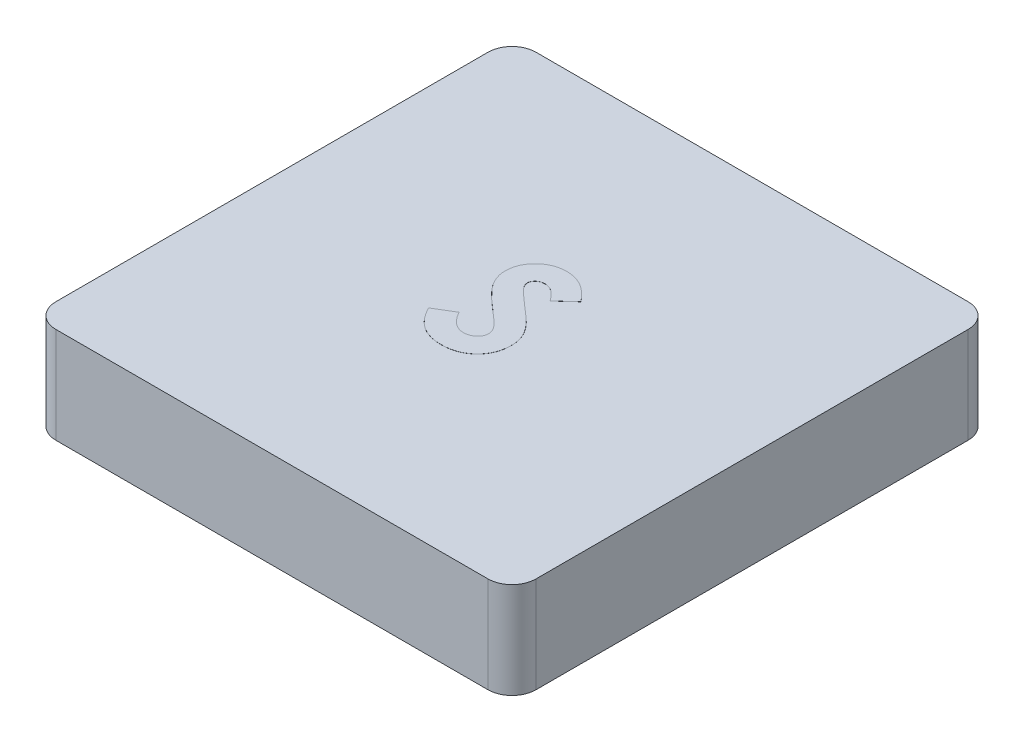
from build123d import *

# Parameters (mm, degrees)
SKETCH1_W           = 12.7
SKETCH1_H           = 12.7
BOSS_EXTRUDE1_DEPTH = 2.54
FILLET1_R           = 0.635
SHELL1_START        = 0.635
SHELL1_OUTLINE_W    = 1.905
SHELL1_OUTLINE_H    = 11.43
SHELL1_DEPTH        = 11.43
SKETCH2_R           = 2.54
BOSS_EXTRUDE2_DEPTH = 1.905
BOSS_EXTRUDE3_DEPTH = 0.00254


# Read off the part's stored shape, not the designer's step: Shell1
with BuildPart() as part:
    # Sketch1 → Boss-Extrude1 (new body)
    with BuildSketch(Plane(origin=(0, 0, 0), x_dir=(1, 0, 0), z_dir=(0, 1, 0))):
        with Locations((6.35, 6.35)):
            Rectangle(SKETCH1_W, SKETCH1_H)
    extrude(amount=BOSS_EXTRUDE1_DEPTH)

    # Fillet1
    fillet1_edges = [part.edges().sort_by_distance(p)[0] for p in [
        (0, 1.27, -12.7),
        (12.7, 1.27, -12.7),
        (12.7, 1.27, 0),
        (0, 1.27, 0),
    ]]
    fillet(fillet1_edges, radius=FILLET1_R)

    # Shell1 outline → Shell1 (cut)
    with BuildSketch(Plane.YZ.offset(SHELL1_START)):
        with Locations((0.9525, -6.35)):
            Rectangle(SHELL1_OUTLINE_W, SHELL1_OUTLINE_H)
    extrude(amount=SHELL1_DEPTH, mode=Mode.SUBTRACT)

    # Sketch2 → Boss-Extrude2 (add)
    with BuildSketch(Plane(origin=(0, 1.905, 0), x_dir=(-1, 0, 0), z_dir=(0, -1, 0))):
        with Locations(Location((-6.35, 6.35, 0), (0, 0, 270))):
            Circle(SKETCH2_R)
    extrude(amount=BOSS_EXTRUDE2_DEPTH)

    # Sketch3 → Boss-Extrude3 (add)
    with BuildSketch(Plane(origin=(0, 2.54, 0), x_dir=(1, 0, 0), z_dir=(0, 1, 0))):
        with BuildLine():
            Line((6.947551282, 7.576776242), (6.521419471, 7.186897436))
            add(Edge.make_bspline(
                [(6.521419471, 7.186897436), (6.503165812, 7.21264612), (6.468121331, 7.262080004), (6.411317883, 7.328273139), (6.354770931, 7.384740809), (6.297956603, 7.431247119), (6.240371318, 7.467509507), (6.182115036, 7.493183679), (6.123518028, 7.509504993), (6.084149883, 7.51153739), (6.064758814, 7.512538462)],
                knots=[0, 0, 0, 0, 1.299362458, 2.494594718, 3.587462134, 4.587049575, 5.512617175, 6.380583204, 7.202344345, 8, 8, 8, 8], degree=3))
            add(Edge.make_bspline(
                [(6.064758814, 7.512538462), (6.046671381, 7.511904137), (6.0117493, 7.510679422), (5.961965283, 7.498505847), (5.917766323, 7.477496044), (5.879195557, 7.45002396), (5.84864182, 7.416926467), (5.82424703, 7.382215707), (5.810510714, 7.343902879), (5.808702744, 7.317588082), (5.807807692, 7.304560697)],
                knots=[0, 0, 0, 0, 1.185010067, 2.2879431, 3.333075148, 4.379039566, 5.372662701, 6.27520591, 7.14612461, 8, 8, 8, 8], degree=3))
            add(Edge.make_bspline(
                [(5.807807692, 7.304560697), (5.808368576, 7.291345451), (5.809498118, 7.264731783), (5.820407957, 7.225726137), (5.836852199, 7.18761308), (5.852565344, 7.164411849), (5.860597155, 7.152552484)],
                knots=[0, 0, 0, 0, 0.967525499, 1.948461899, 2.951351359, 4, 4, 4, 4], degree=3))
            add(Edge.make_bspline(
                [(5.860597155, 7.152552484), (5.867898941, 7.143334324), (5.884706688, 7.122115336), (5.916755618, 7.088507766), (5.957002343, 7.047335552), (6.006995642, 7.000014485), (6.064660156, 6.944842714), (6.132668709, 6.883989063), (6.209063719, 6.815568965), (6.263363522, 6.767923686), (6.291817107, 6.742957131)],
                knots=[0, 0, 0, 0, 0.473873513, 1.090794244, 1.870441696, 2.795289791, 3.865433203, 5.087734844, 6.473946851, 8, 8, 8, 8], degree=3))
            add(Edge.make_bspline(
                [(6.291817107, 6.742957131), (6.31852489, 6.719842892), (6.369210714, 6.675976869), (6.441326575, 6.613716092), (6.504704406, 6.557701589), (6.560267478, 6.508774018), (6.607173508, 6.466420016), (6.645619689, 6.430437133), (6.676075577, 6.401525888), (6.693387966, 6.384063478), (6.700776442, 6.376610978)],
                knots=[0, 0, 0, 0, 1.543621617, 2.929473131, 4.163658386, 5.240097082, 6.164993805, 6.925417477, 7.541396219, 8, 8, 8, 8], degree=3))
            add(Edge.make_bspline(
                [(6.700776442, 6.376610978), (6.72880678, 6.346276149), (6.782690932, 6.287961956), (6.852721334, 6.197593297), (6.910358621, 6.109375058), (6.954947919, 6.021647272), (6.98862355, 5.9331442), (7.012365316, 5.84169531), (7.026584417, 5.746345018), (7.02816307, 5.681280084), (7.028961538, 5.648370793)],
                knots=[0, 0, 0, 0, 1.206664779, 2.319633467, 3.337109185, 4.282041471, 5.190008762, 6.099243693, 7.03861361, 8, 8, 8, 8], degree=3))
            add(Edge.make_bspline(
                [(7.028961538, 5.648370793), (7.028393209, 5.616304725), (7.027278125, 5.553389906), (7.013620483, 5.46132344), (6.994145488, 5.373211837), (6.96403373, 5.290013874), (6.927333696, 5.210363884), (6.881324904, 5.135502559), (6.827293886, 5.064672272), (6.765366044, 4.999139201), (6.696866497, 4.939672482), (6.623394222, 4.886733804), (6.544230772, 4.843026182), (6.460052505, 4.807036073), (6.370904481, 4.77931601), (6.276892901, 4.7588283), (6.17787397, 4.746531899), (6.110163397, 4.745246456), (6.075571114, 4.744589744)],
                knots=[0, 0, 0, 0, 1.043214005, 2.046824704, 3.02475056, 3.976699089, 4.921714032, 5.875962561, 6.831408892, 7.817874052, 8.806269674, 9.781291748, 10.760897367, 11.74438705, 12.757449933, 13.795994037, 14.874007457, 16, 16, 16, 16], degree=3))
            add(Edge.make_bspline(
                [(6.075571114, 4.744589744), (6.048416466, 4.745071485), (5.994634689, 4.74602561), (5.915368481, 4.753815242), (5.838827997, 4.766386881), (5.765099453, 4.784405794), (5.693850688, 4.807238201), (5.625078777, 4.835127112), (5.559258474, 4.868504794), (5.495891752, 4.906684869), (5.435286652, 4.951016965), (5.376676846, 5.000594728), (5.320644503, 5.056180684), (5.266920509, 5.117643377), (5.215848607, 5.185156853), (5.165757029, 5.257780861), (5.118871997, 5.336863206), (5.089909027, 5.392340111), (5.075115385, 5.420676482)],
                knots=[0, 0, 0, 0, 1.016823716, 2.013894106, 2.979844003, 3.91962641, 4.853723003, 5.779685073, 6.695824784, 7.614987388, 8.547259901, 9.504950863, 10.487499108, 11.500346958, 12.559593716, 13.656357062, 14.802919212, 16, 16, 16, 16], degree=3))
            Line((5.075115385, 5.420676482), (5.576297276, 5.721512821))
            add(Edge.make_bspline(
                [(5.576297276, 5.721512821), (5.594801911, 5.689347337), (5.630276879, 5.627683355), (5.690392527, 5.54482998), (5.751977941, 5.473879779), (5.816456918, 5.416086802), (5.883045419, 5.370678281), (5.952065082, 5.338226202), (6.023564398, 5.318138402), (6.072266484, 5.315685218), (6.096559696, 5.314461538)],
                knots=[0, 0, 0, 0, 1.283663364, 2.460892379, 3.537111102, 4.529833553, 5.449777664, 6.316464042, 7.160231139, 8, 8, 8, 8], degree=3))
            add(Edge.make_bspline(
                [(6.096559696, 5.314461538), (6.12126937, 5.315460861), (6.169209736, 5.317399693), (6.237638475, 5.335308096), (6.300376534, 5.363425604), (6.354606849, 5.403545409), (6.40052566, 5.449849762), (6.434416378, 5.501365473), (6.455706756, 5.557104227), (6.457957665, 5.595824033), (6.459089744, 5.615297877)],
                knots=[0, 0, 0, 0, 1.13588714, 2.203786484, 3.234766741, 4.283437687, 5.291419208, 6.222934724, 7.106237994, 8, 8, 8, 8], degree=3))
            add(Edge.make_bspline(
                [(6.459089744, 5.615297877), (6.458044316, 5.633415119), (6.455920629, 5.670218563), (6.440278206, 5.724939365), (6.415824328, 5.779635282), (6.386893665, 5.824498352), (6.357453094, 5.862060985), (6.329301267, 5.894607307), (6.295019789, 5.930565296), (6.254695583, 5.969980182), (6.208861436, 6.013198947), (6.157478739, 6.060217356), (6.099959106, 6.110621236), (6.059304117, 6.14495586), (6.038046074, 6.162909054)],
                knots=[0, 0, 0, 0, 0.916159276, 1.861089862, 2.860218735, 3.940849679, 4.552606315, 5.27541173, 6.11797699, 7.06649574, 8.129236253, 9.306560635, 10.591630461, 12, 12, 12, 12], degree=3))
            add(Edge.make_bspline(
                [(6.038046074, 6.162909054), (5.997633688, 6.197101808), (5.920070088, 6.262728051), (5.810462881, 6.359655946), (5.711696974, 6.450243946), (5.624625414, 6.535611915), (5.548138776, 6.614183306), (5.482755059, 6.686596305), (5.429192535, 6.75340948), (5.372829528, 6.832545214), (5.319273403, 6.928977544), (5.272985712, 7.044996816), (5.242956212, 7.161001367), (5.239591824, 7.238880433), (5.237935897, 7.277211939)],
                knots=[0, 0, 0, 0, 1.345494975, 2.582412109, 3.71882943, 4.751509156, 5.681369928, 6.505683931, 7.230279997, 7.856715994, 8.973648664, 10.023341002, 11.027102913, 12, 12, 12, 12], degree=3))
            add(Edge.make_bspline(
                [(5.237935897, 7.277211939), (5.238624595, 7.304394586), (5.239981404, 7.35794732), (5.252084347, 7.436688812), (5.270172657, 7.512667736), (5.296442076, 7.585606886), (5.33053661, 7.655414903), (5.371943098, 7.722433526), (5.421304502, 7.786045931), (5.476931473, 7.846209948), (5.538218153, 7.901193012), (5.603710758, 7.949721076), (5.673038596, 7.990708584), (5.745777553, 8.024710699), (5.822378363, 8.050737157), (5.90227671, 8.069186008), (5.985587195, 8.080158796), (6.042253188, 8.08165042), (6.07111899, 8.082410256)],
                knots=[0, 0, 0, 0, 1.010766082, 1.991317756, 2.957454644, 3.913069143, 4.869106762, 5.843196583, 6.838735724, 7.860187025, 8.887984031, 9.89767229, 10.887916223, 11.879572884, 12.879850636, 13.892031539, 14.926195476, 16, 16, 16, 16], degree=3))
            add(Edge.make_bspline(
                [(6.07111899, 8.082410256), (6.108527641, 8.081041768), (6.183049652, 8.078315594), (6.293232593, 8.056997805), (6.400854684, 8.023473336), (6.487578582, 7.983029753), (6.556583169, 7.943852034), (6.609468739, 7.907782126), (6.663282653, 7.866462108), (6.718458887, 7.819761769), (6.773972181, 7.766801214), (6.831401043, 7.70884121), (6.889962936, 7.645380848), (6.92801888, 7.600045059), (6.947551282, 7.576776242)],
                knots=[0, 0, 0, 0, 1.282922637, 2.555718331, 3.837320111, 5.142675274, 5.830281639, 6.55870424, 7.337177975, 8.157850921, 9.037902056, 9.96903443, 10.957596896, 12, 12, 12, 12], degree=3))
        make_face()
    extrude(amount=BOSS_EXTRUDE3_DEPTH)


solid = part.part
